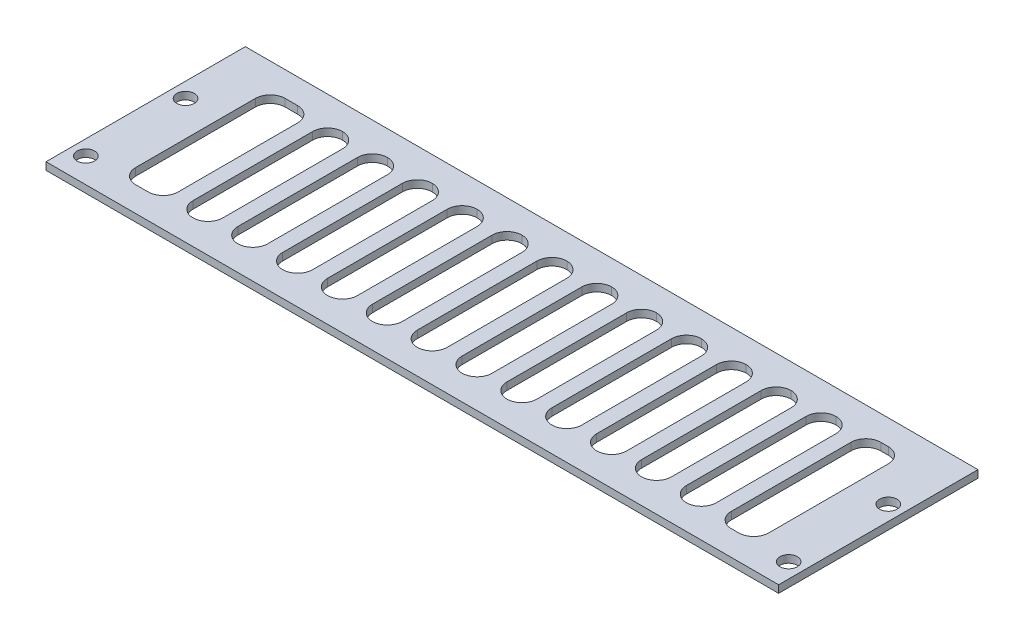
from build123d import *

# Parameters (mm, degrees)
SKETCH_2_W          = 147
SKETCH_2_H          = 40
EXTRUDE_1_DEPTH     = 1.5
SKETCH_3_R          = 1.75
CUT_EXTRUDE_1_DEPTH = 10
SKETCH_4_W          = 8.5
SKETCH_4_H          = 30
SKETCH_4_W_2        = 6
SKETCH_4_W_3        = 7.5
CUT_EXTRUDE_2_DEPTH = 10
FILLET_1_R          = 3


with BuildPart() as part:
    # 草图2 → 凸台-拉伸1 (new body)
    with BuildSketch(Plane(origin=(0, 0, 0), x_dir=(1, 0, 0), z_dir=(0, 1, 0))):
        Rectangle(SKETCH_2_W, SKETCH_2_H)
    extrude(amount=EXTRUDE_1_DEPTH)

    # 草图3 → 切除-拉伸1 (cut)
    with BuildSketch(Plane.XZ):
        with Locations(Location((70.5, 15, 0), (0, 0, 270))):
            Circle(SKETCH_3_R)
        with Locations(Location((70.5, -5, 0), (0, 0, 270))):
            Circle(SKETCH_3_R)
        with Locations(Location((-70.5, 15, 0), (0, 0, 270))):
            Circle(SKETCH_3_R)
        with Locations(Location((-70.5, -5, 0), (0, 0, 270))):
            Circle(SKETCH_3_R)
    extrude(amount=-CUT_EXTRUDE_1_DEPTH, mode=Mode.SUBTRACT)

    # 草图4 → 切除-拉伸2 (cut)
    with BuildSketch(Plane(origin=(0, 1.5, 0), x_dir=(1, 0, 0), z_dir=(0, 1, 0))):
        with Locations((-59.25, 0)):
            Rectangle(SKETCH_4_W, SKETCH_4_H)
        with Locations((-49, 0)):
            Rectangle(SKETCH_4_W_2, SKETCH_4_H)
        with Locations((-40, 0)):
            Rectangle(SKETCH_4_W_2, SKETCH_4_H)
        with Locations((-31, 0)):
            Rectangle(SKETCH_4_W_2, SKETCH_4_H)
        with Locations((-22, 0)):
            Rectangle(SKETCH_4_W_2, SKETCH_4_H)
        with Locations((-13, 0)):
            Rectangle(SKETCH_4_W_2, SKETCH_4_H)
        with Locations((-4, 0)):
            Rectangle(SKETCH_4_W_2, SKETCH_4_H)
        with Locations((5, 0)):
            Rectangle(SKETCH_4_W_2, SKETCH_4_H)
        with Locations((14, 0)):
            Rectangle(SKETCH_4_W_2, SKETCH_4_H)
        with Locations((23, 0)):
            Rectangle(SKETCH_4_W_2, SKETCH_4_H)
        with Locations((32, 0)):
            Rectangle(SKETCH_4_W_2, SKETCH_4_H)
        with Locations((41, 0)):
            Rectangle(SKETCH_4_W_2, SKETCH_4_H)
        with Locations((50, 0)):
            Rectangle(SKETCH_4_W_2, SKETCH_4_H)
        with Locations((59.75, 0)):
            Rectangle(SKETCH_4_W_3, SKETCH_4_H)
    extrude(amount=-CUT_EXTRUDE_2_DEPTH, mode=Mode.SUBTRACT)

    # 圆角1
    fillet_1_edges = [part.edges().sort_by_distance(p)[0] for p in [
        (-52, 0.75, -15),
        (-46, 0.75, -15),
        (-37, 0.75, 15),
        (-43, 0.75, 15),
        (-43, 0.75, -15),
        (-37, 0.75, -15),
        (-28, 0.75, 15),
        (-34, 0.75, 15),
        (-34, 0.75, -15),
        (-28, 0.75, -15),
        (-19, 0.75, 15),
        (-25, 0.75, 15),
        (-25, 0.75, -15),
        (-19, 0.75, -15),
        (-10, 0.75, 15),
        (-16, 0.75, 15),
        (-16, 0.75, -15),
        (-10, 0.75, -15),
        (-1, 0.75, 15),
        (-7, 0.75, 15),
        (-7, 0.75, -15),
        (-1, 0.75, -15),
        (8, 0.75, 15),
        (2, 0.75, 15),
        (2, 0.75, -15),
        (8, 0.75, -15),
        (17, 0.75, 15),
        (11, 0.75, 15),
        (11, 0.75, -15),
        (17, 0.75, -15),
        (26, 0.75, 15),
        (20, 0.75, 15),
        (20, 0.75, -15),
        (26, 0.75, -15),
        (35, 0.75, 15),
        (29, 0.75, 15),
        (29, 0.75, -15),
        (35, 0.75, -15),
        (44, 0.75, 15),
        (38, 0.75, 15),
        (38, 0.75, -15),
        (44, 0.75, -15),
        (53, 0.75, 15),
        (47, 0.75, 15),
        (47, 0.75, -15),
        (53, 0.75, -15),
        (56, 0.75, 15),
        (56, 0.75, -15),
        (63.5, 0.75, -15),
        (63.5, 0.75, 15),
        (-55, 0.75, 15),
        (-63.5, 0.75, 15),
        (-63.5, 0.75, -15),
        (-55, 0.75, -15),
        (-46, 0.75, 15),
        (-52, 0.75, 15),
    ]]
    fillet(fillet_1_edges, radius=FILLET_1_R - 0.0001)  # a hair under: the kernel refuses the full size


solid = part.part
